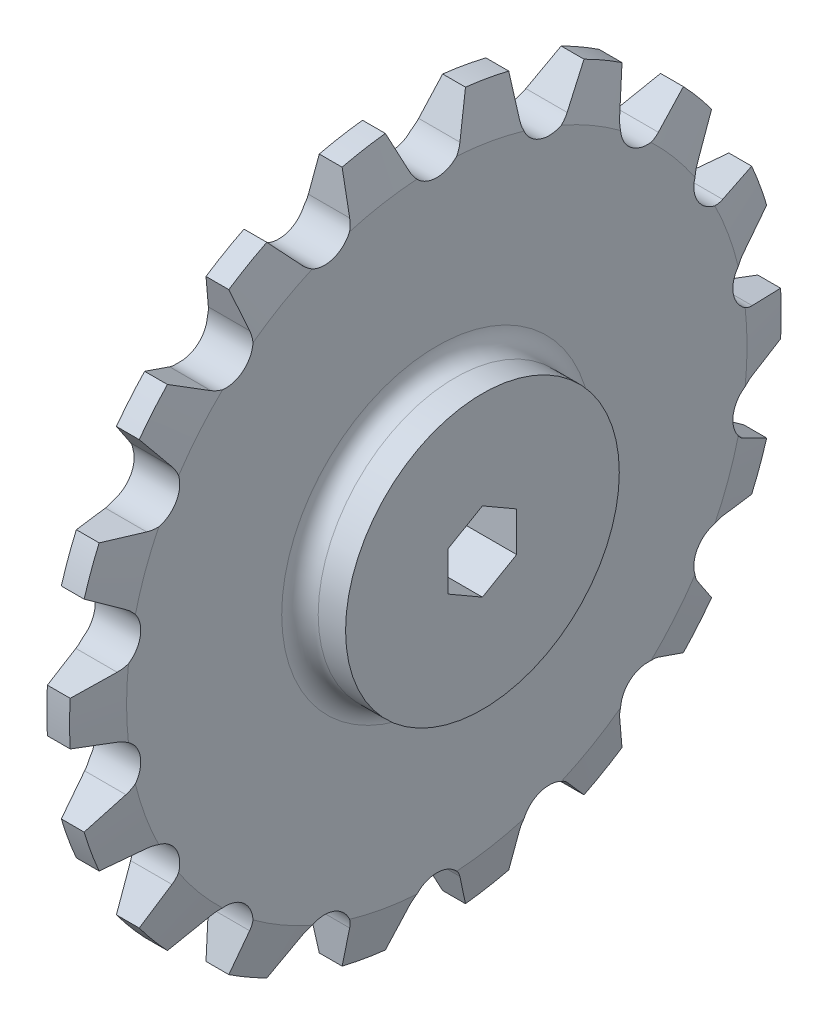
from build123d import *

# Parameters (mm, degrees)
CUT_EXTRUDE1_DEPTH      = 73.590249345
CIRPATTERN1_COUNT       = 18
CUT_EXTRUDE2_DEPTH      = 75.300157292
CUT_EXTRUDE2_DEPTH_BACK = 75.300157292
FILLET1_R               = 2.54


with BuildPart() as part:
    # Sketch1 → Revolve1 (revolve)
    with BuildSketch(Plane(origin=(0, 0, 0), x_dir=(1, 0, 0), z_dir=(0, 1, 0))):
        Polygon((-4.7625, 49.53), (-6.35, 43.18), (-6.35, 19.05), (-19.05, 19.05), (-19.05, 0), (6.35, 0), (6.35, 19.05), (0, 19.05), (0, 43.18), (-1.5875, 49.53), align=None)
    revolve(axis=Axis((-19.05, 0, 0), (1, 0, 0)))

    # Sketch2 → Cut-Extrude1 (cut, symmetric)
    with BuildSketch(Plane(origin=(0, 0, 0), x_dir=(0, 0, -1), z_dir=(1, 0, 0))):
        with BuildLine():
            Line((-7.98180394, 55.024010242), (-3.519981019, 44.252216833))
            ThreePointArc((-3.519981019, 44.252216833), (0, 41.90024071), (3.519981019, 44.252216833))
            Line((3.519981019, 44.252216833), (7.98180394, 55.024010242))
            Line((7.98180394, 55.024010242), (-7.98180394, 55.024010242))
        make_face()
    cut_extrude1 = extrude(amount=CUT_EXTRUDE1_DEPTH, both=True, mode=Mode.SUBTRACT)

    # CirPattern1: Cut-Extrude1 ×18 about axis
    cirpattern1_axis = Axis((6.35, 0, 0), (-1, 0, 0))
    for i in range(1, CIRPATTERN1_COUNT):
        add(cut_extrude1.rotate(cirpattern1_axis, i * 360 / CIRPATTERN1_COUNT), mode=Mode.SUBTRACT)

    # Sketch3 → Cut-Extrude2 (cut, two sides: drawn at the far end of the back side and taken through both)
    with BuildSketch(Plane.ZY.offset(19.05).offset(-CUT_EXTRUDE2_DEPTH_BACK)):
        Polygon((0, 5.499261314), (-4.7625, 2.749630657), (-4.7625, -2.749630657), (0, -5.499261314), (4.7625, -2.749630657), (4.7625, 2.749630657), align=None)
    extrude(amount=CUT_EXTRUDE2_DEPTH + CUT_EXTRUDE2_DEPTH_BACK, mode=Mode.SUBTRACT)

    # Fillet1
    fillet1_edges = [part.edges().sort_by_distance(p)[0] for p in [
        (0, 0, 19.05),
        (-6.35, 0, 19.05),
    ]]
    fillet(fillet1_edges, radius=FILLET1_R)


solid = part.part
